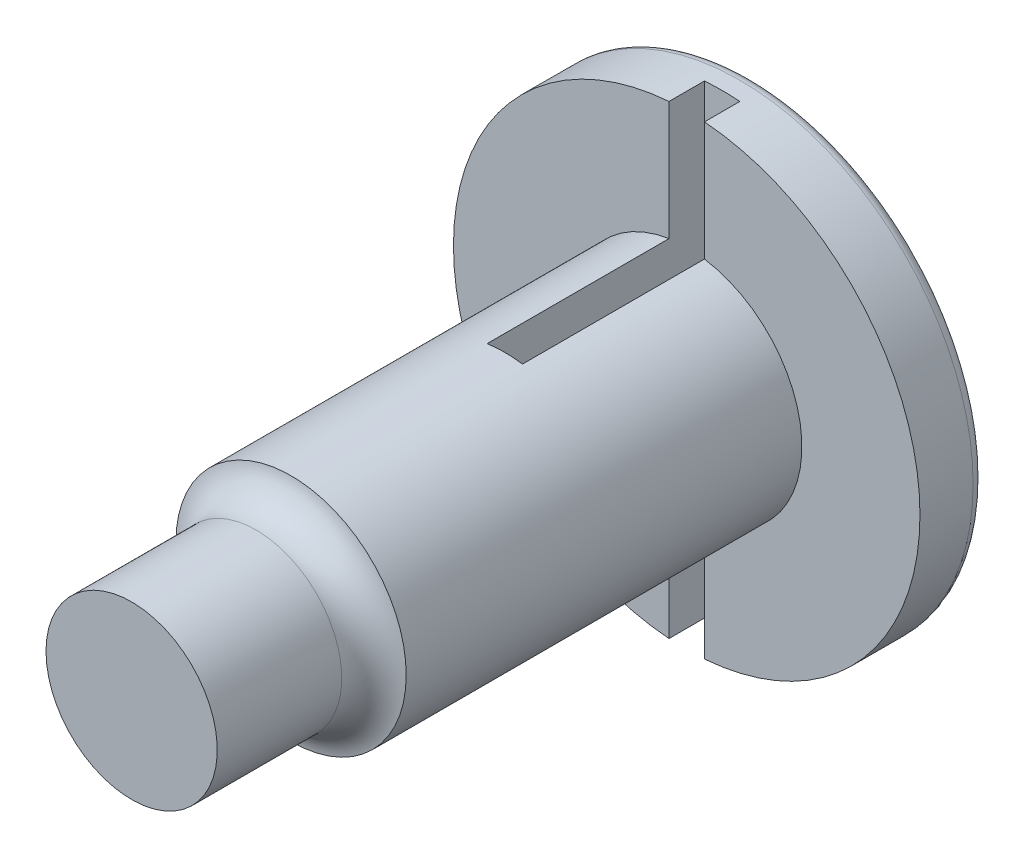
from build123d import *

# Parameters (mm, degrees)
SKETCH1_R               = 197.5
BOSS_EXTRUDE1_DEPTH     = 55
SKETCH2_R               = 97.5
BOSS_EXTRUDE2_DEPTH     = 335
SKETCH3_R               = 72.5
BOSS_EXTRUDE3_DEPTH     = 470
CUT_EXTRUDE1_DEPTH      = 30
CUT_EXTRUDE2_DEPTH      = 15
CUT_EXTRUDE2_DEPTH_BACK = 15
CUT_EXTRUDE3_DEPTH      = 235
CUT_EXTRUDE3_DEPTH_BACK = 285
SKETCH8_R               = 57.5
FILLET1_R               = 30
FILLET2_R               = 10


with BuildPart() as part:
    # Sketch1 → Boss-Extrude1 (new body)
    with BuildSketch(Plane.XY):
        Circle(SKETCH1_R)
    extrude(amount=-BOSS_EXTRUDE1_DEPTH)

    # Sketch2 → Boss-Extrude2 (add)
    with BuildSketch(Plane.XY):
        Circle(SKETCH2_R)
    extrude(amount=BOSS_EXTRUDE2_DEPTH)

    # Sketch3 → Boss-Extrude3 (add)
    with BuildSketch(Plane.XY):
        with Locations(Location((0, 0, 0), (0, 0, 180))):
            Circle(SKETCH3_R)
    extrude(amount=BOSS_EXTRUDE3_DEPTH)

    # Sketch4 → Cut-Extrude1 (cut)
    with BuildSketch(Plane.XY):
        Polygon((0, 197.5), (-15, 197.5), (-15, -197.5), (0, -197.5), (15, -197.5), (15, 197.5), align=None)
    extrude(amount=-CUT_EXTRUDE1_DEPTH, mode=Mode.SUBTRACT)

    # Sketch7 → Cut-Extrude2 (cut, two sides: drawn at the far end of the back side and taken through both)
    with BuildSketch(Plane(origin=(0, 0, 0), x_dir=(0, 0, -1), z_dir=(1, 0, 0)).offset(-CUT_EXTRUDE2_DEPTH_BACK)):
        Polygon((0, 0), (0, 273), (-161.375, 273), (-138.625, -273), (0, -273), align=None)
    extrude(amount=CUT_EXTRUDE2_DEPTH + CUT_EXTRUDE2_DEPTH_BACK, mode=Mode.SUBTRACT)

    # Sketch8 → Cut-Extrude3 (cut, two sides: drawn at the far end of the back side and taken through both)
    with BuildSketch(Plane.XY.offset(-CUT_EXTRUDE3_DEPTH_BACK)):
        Circle(SKETCH8_R)
    extrude(amount=CUT_EXTRUDE3_DEPTH + CUT_EXTRUDE3_DEPTH_BACK, mode=Mode.SUBTRACT)

    # Fillet1
    # the kernel refuses this fillet: 30 mm, written as the material it adds along each edge
    with BuildSketch(Plane(origin=(0, 0, 335), x_dir=(-1, 0, 0), z_dir=(0, -1, 0))) as fillet1_piece_1:
        with BuildLine():
            CenterArc((102.5, -29.580398916), FILLET1_R, 99.594068227, 80.405931773)
            Line((72.5, -29.580398916), (71.9, -29.580398916))
            Line((71.9, -29.580398916), (71.9, 0))
            Line((71.9, 0), (72.5, 0.6))
            ThreePointArc((72.5, 0.6), (85, 0.6), (97.4, 0.591607978))
            Line((97.4, 0.591607978), (97.5, 0))
        make_face()
    revolve(axis=Axis((0, 0, 335), (0, 0, -1)))

    # Fillet2
    fillet2_edges = [part.edges().sort_by_distance(p)[0] for p in [
        (-197.5, 0, -55),
    ]]
    fillet(fillet2_edges, radius=FILLET2_R)


solid = part.part
